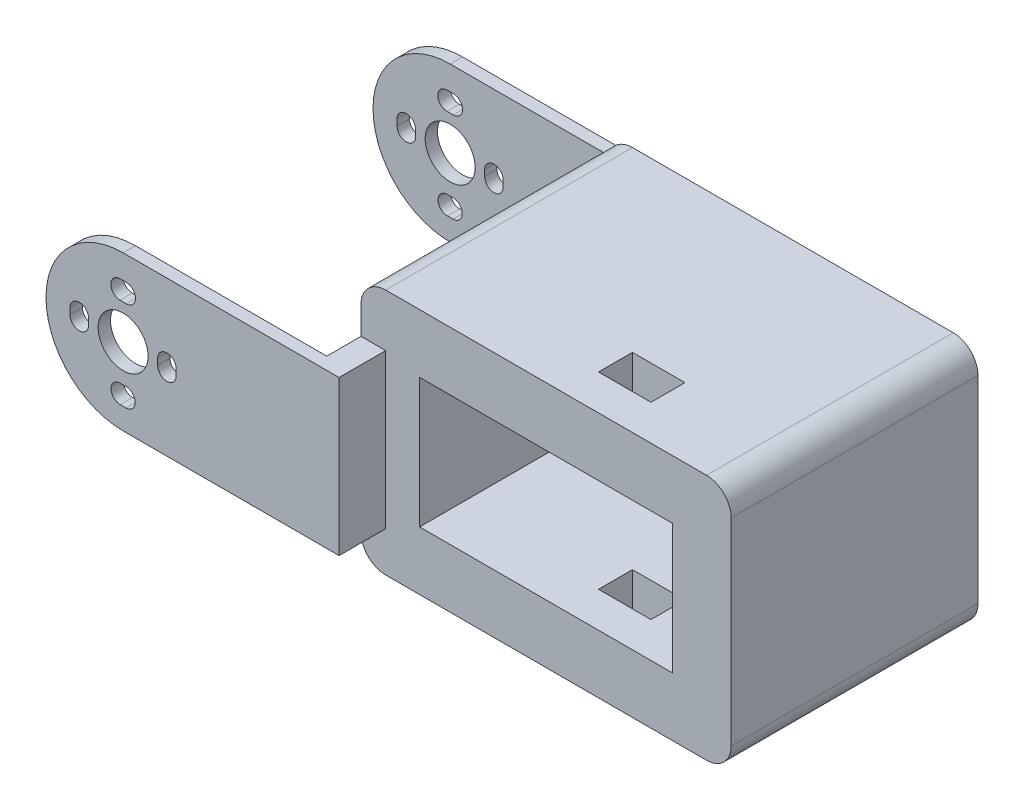
from build123d import *

# Parameters (mm, degrees)
SKETCH1_W           = 60
SKETCH1_H           = 40
SKETCH1_W_2         = 41
SKETCH1_H_2         = 21
BOSS_EXTRUDE1_DEPTH = 40
SKETCH2_W           = 4
SKETCH2_H           = 25
BOSS_EXTRUDE2_DEPTH = 5.55
SKETCH2_2_W         = 4
SKETCH2_2_H         = 25
BOSS_EXTRUDE3_DEPTH = 45.55
SKETCH3_R           = 4.05
BOSS_EXTRUDE6_DEPTH = 2
BOSS_EXTRUDE7_START = -53
SKETCH3_8_R         = 4.05
BOSS_EXTRUDE7_DEPTH = 53
CUT_EXTRUDE1_START  = -51
SKETCH3_11_R        = 4.05
CUT_EXTRUDE1_DEPTH  = 51
SKETCH_1_W          = 8.5
SKETCH_1_H          = 5.5
CUT_EXTRUDE_1_DEPTH = 40
FILLET_2_R          = 4
FILLET_3_R          = 4
FILLET_4_R          = 4
FILLET_5_R          = 4


with BuildPart() as part:
    # Sketch1 → Boss-Extrude1 (new body)
    with BuildSketch(Plane.XY):
        with Locations((0.904162196, -5.136072895)):
            Rectangle(SKETCH1_W, SKETCH1_H)
        with Locations((0.904162196, -5.136072895)):
            Rectangle(SKETCH1_W_2, SKETCH1_H_2, mode=Mode.SUBTRACT)
    extrude(amount=BOSS_EXTRUDE1_DEPTH)

    # Sketch2 → Boss-Extrude2 (add)
    with BuildSketch(Plane.XY.offset(40)):
        with Locations((-27.095837804, -6.136072895)):
            Rectangle(SKETCH2_W, SKETCH2_H)
    extrude(amount=BOSS_EXTRUDE2_DEPTH)

    # Sketch2<2> → Boss-Extrude3 (add)
    with BuildSketch(Plane.XY.offset(40)):
        with Locations((-27.095837804, -6.136072895)):
            Rectangle(SKETCH2_2_W, SKETCH2_2_H)
    extrude(amount=-BOSS_EXTRUDE3_DEPTH)

    # Sketch3 → Boss-Extrude6 (add)
    with BuildSketch(Plane.XY.offset(45.55)):
        with BuildLine():
            Line((-25.095837804, -18.636072895), (-25.095837804, 6.363927105))
            Line((-25.095837804, 6.363927105), (-60.095837804, 6.363927105))
            ThreePointArc((-60.095837804, 6.363927105), (-72.595837804, -6.136072895), (-60.095837804, -18.636072895))
            Line((-60.095837804, -18.636072895), (-25.095837804, -18.636072895))
        make_face()
        with BuildLine():
            Line((-51.495837804, -5.636072895), (-51.495837804, -6.636072895))
            ThreePointArc((-51.495837804, -6.636072895), (-52.995837804, -8.136072895), (-54.495837804, -6.636072895))
            Line((-54.495837804, -6.636072895), (-54.495837804, -5.636072895))
            ThreePointArc((-54.495837804, -5.636072895), (-52.995837804, -4.136072895), (-51.495837804, -5.636072895))
        make_face(mode=Mode.SUBTRACT)
        with BuildLine():
            Line((-59.635749439, -15.176248856), (-60.555926168, -15.176248856))
            ThreePointArc((-60.555926168, -15.176248856), (-62.055926168, -13.676248856), (-60.555926168, -12.176248856))
            Line((-60.555926168, -12.176248856), (-59.635749439, -12.176248856))
            ThreePointArc((-59.635749439, -12.176248856), (-58.135749439, -13.676248856), (-59.635749439, -15.176248856))
        make_face(mode=Mode.SUBTRACT)
        with Locations((-60.095837804, -6.136072895)):
            Circle(SKETCH3_R, mode=Mode.SUBTRACT)
        with BuildLine():
            Line((-59.595837804, -0.536072895), (-60.595837804, -0.536072895))
            ThreePointArc((-60.595837804, -0.536072895), (-62.095837804, 0.963927105), (-60.595837804, 2.463927105))
            Line((-60.595837804, 2.463927105), (-59.595837804, 2.463927105))
            ThreePointArc((-59.595837804, 2.463927105), (-58.095837804, 0.963927105), (-59.595837804, -0.536072895))
        make_face(mode=Mode.SUBTRACT)
        with BuildLine():
            ThreePointArc((-68.695837804, -5.636072895), (-67.195837804, -4.136072895), (-65.695837804, -5.636072895))
            Line((-65.695837804, -5.636072895), (-65.695837804, -6.636072895))
            ThreePointArc((-65.695837804, -6.636072895), (-67.195837804, -8.136072895), (-68.695837804, -6.636072895))
            Line((-68.695837804, -6.636072895), (-68.695837804, -5.636072895))
        make_face(mode=Mode.SUBTRACT)
    extrude(amount=BOSS_EXTRUDE6_DEPTH)

    # Sketch3<8> → Boss-Extrude7 (add)
    with BuildSketch(Plane.XY.offset(45.55).offset(BOSS_EXTRUDE7_START)):
        with BuildLine():
            Line((-25.095837804, -18.636072895), (-25.095837804, 6.363927105))
            Line((-25.095837804, 6.363927105), (-60.095837804, 6.363927105))
            ThreePointArc((-60.095837804, 6.363927105), (-72.595837804, -6.136072895), (-60.095837804, -18.636072895))
            Line((-60.095837804, -18.636072895), (-25.095837804, -18.636072895))
        make_face()
        with BuildLine():
            Line((-51.495837804, -5.636072895), (-51.495837804, -6.636072895))
            ThreePointArc((-51.495837804, -6.636072895), (-52.995837804, -8.136072895), (-54.495837804, -6.636072895))
            Line((-54.495837804, -6.636072895), (-54.495837804, -5.636072895))
            ThreePointArc((-54.495837804, -5.636072895), (-52.995837804, -4.136072895), (-51.495837804, -5.636072895))
        make_face(mode=Mode.SUBTRACT)
        with BuildLine():
            Line((-59.635749439, -15.176248856), (-60.555926168, -15.176248856))
            ThreePointArc((-60.555926168, -15.176248856), (-62.055926168, -13.676248856), (-60.555926168, -12.176248856))
            Line((-60.555926168, -12.176248856), (-59.635749439, -12.176248856))
            ThreePointArc((-59.635749439, -12.176248856), (-58.135749439, -13.676248856), (-59.635749439, -15.176248856))
        make_face(mode=Mode.SUBTRACT)
        with Locations((-60.095837804, -6.136072895)):
            Circle(SKETCH3_8_R, mode=Mode.SUBTRACT)
        with BuildLine():
            Line((-59.595837804, -0.536072895), (-60.595837804, -0.536072895))
            ThreePointArc((-60.595837804, -0.536072895), (-62.095837804, 0.963927105), (-60.595837804, 2.463927105))
            Line((-60.595837804, 2.463927105), (-59.595837804, 2.463927105))
            ThreePointArc((-59.595837804, 2.463927105), (-58.095837804, 0.963927105), (-59.595837804, -0.536072895))
        make_face(mode=Mode.SUBTRACT)
        with BuildLine():
            ThreePointArc((-68.695837804, -5.636072895), (-67.195837804, -4.136072895), (-65.695837804, -5.636072895))
            Line((-65.695837804, -5.636072895), (-65.695837804, -6.636072895))
            ThreePointArc((-65.695837804, -6.636072895), (-67.195837804, -8.136072895), (-68.695837804, -6.636072895))
            Line((-68.695837804, -6.636072895), (-68.695837804, -5.636072895))
        make_face(mode=Mode.SUBTRACT)
    extrude(amount=BOSS_EXTRUDE7_DEPTH)

    # Sketch3<11> → Cut-Extrude1 (cut)
    with BuildSketch(Plane.XY.offset(45.55).offset(CUT_EXTRUDE1_START)):
        with BuildLine():
            Line((-29.095837804, -18.636072895), (-29.095837804, 6.363927105))
            Line((-29.095837804, 6.363927105), (-60.095837804, 6.363927105))
            ThreePointArc((-60.095837804, 6.363927105), (-72.595837804, -6.136072895), (-60.095837804, -18.636072895))
            Line((-60.095837804, -18.636072895), (-29.095837804, -18.636072895))
        make_face()
        with BuildLine():
            Line((-59.635749439, -15.176248856), (-60.555926168, -15.176248856))
            ThreePointArc((-60.555926168, -15.176248856), (-62.055926168, -13.676248856), (-60.555926168, -12.176248856))
            Line((-60.555926168, -12.176248856), (-59.635749439, -12.176248856))
            ThreePointArc((-59.635749439, -12.176248856), (-58.135749439, -13.676248856), (-59.635749439, -15.176248856))
        make_face(mode=Mode.SUBTRACT)
        with Locations((-60.095837804, -6.136072895)):
            Circle(SKETCH3_11_R, mode=Mode.SUBTRACT)
        with BuildLine():
            Line((-59.595837804, -0.536072895), (-60.595837804, -0.536072895))
            ThreePointArc((-60.595837804, -0.536072895), (-62.095837804, 0.963927105), (-60.595837804, 2.463927105))
            Line((-60.595837804, 2.463927105), (-59.595837804, 2.463927105))
            ThreePointArc((-59.595837804, 2.463927105), (-58.095837804, 0.963927105), (-59.595837804, -0.536072895))
        make_face(mode=Mode.SUBTRACT)
        with BuildLine():
            ThreePointArc((-54.495837804, -5.636072895), (-52.995837804, -4.136072895), (-51.495837804, -5.636072895))
            Line((-51.495837804, -5.636072895), (-51.495837804, -6.636072895))
            ThreePointArc((-51.495837804, -6.636072895), (-52.995837804, -8.136072895), (-54.495837804, -6.636072895))
            Line((-54.495837804, -6.636072895), (-54.495837804, -5.636072895))
        make_face(mode=Mode.SUBTRACT)
        with BuildLine():
            ThreePointArc((-68.695837804, -5.636072895), (-67.195837804, -4.136072895), (-65.695837804, -5.636072895))
            Line((-65.695837804, -5.636072895), (-65.695837804, -6.636072895))
            ThreePointArc((-65.695837804, -6.636072895), (-67.195837804, -8.136072895), (-68.695837804, -6.636072895))
            Line((-68.695837804, -6.636072895), (-68.695837804, -5.636072895))
        make_face(mode=Mode.SUBTRACT)
    extrude(amount=CUT_EXTRUDE1_DEPTH, mode=Mode.SUBTRACT)

    # 草圖1 → 除料-伸長1 (cut)
    with BuildSketch(Plane(origin=(0, 14.863927105, 0), x_dir=(1, 0, 0), z_dir=(0, 1, 0))):
        with Locations((7.904162196, -31.5)):
            Rectangle(SKETCH_1_W, SKETCH_1_H)
    extrude(amount=-CUT_EXTRUDE_1_DEPTH, mode=Mode.SUBTRACT)

    # 圓角2
    fillet_2_edges = [part.edges().sort_by_distance(p)[0] for p in [
        (-29.095837804, -25.136072895, 20),
    ]]
    fillet(fillet_2_edges, radius=FILLET_2_R)

    # 圓角3
    fillet_3_edges = [part.edges().sort_by_distance(p)[0] for p in [
        (30.904162196, -25.136072895, 20),
    ]]
    fillet(fillet_3_edges, radius=FILLET_3_R)

    # 圓角4
    fillet_4_edges = [part.edges().sort_by_distance(p)[0] for p in [
        (30.904162196, 14.863927105, 20),
    ]]
    fillet(fillet_4_edges, radius=FILLET_4_R)

    # 圓角5
    fillet_5_edges = [part.edges().sort_by_distance(p)[0] for p in [
        (-29.095837804, 14.863927105, 20),
    ]]
    fillet(fillet_5_edges, radius=FILLET_5_R)


solid = part.part
